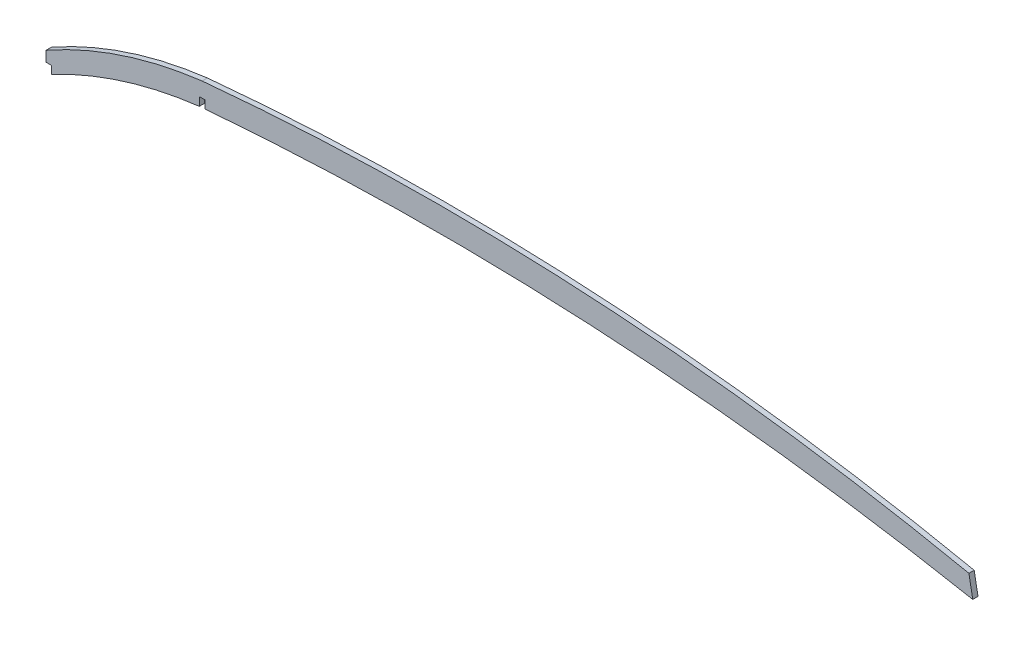
from build123d import *

# Parameters (mm, degrees)
BOSS_EXTRUDE1_DEPTH = 3.175
SKETCH2_W           = 3.3528
SKETCH2_H           = 6.477
SKETCH2_W_2         = 3.3782
SKETCH2_H_2         = 6.2738
CUT_EXTRUDE1_DEPTH  = 577.346072705


with BuildPart() as part:
    # Sketch1 → Boss-Extrude1 (new body)
    with BuildSketch(Plane.XY):
        with BuildLine():
            Line((557.916984218, 99.326538403), (555.638244479, 111.822940833))
            ThreePointArc((555.638244479, 111.822940833), (325.782502236, 142.132503557), (93.98, 137.668))
            ThreePointArc((93.98, 137.668), (45.466310815, 126.795024577), (0, 106.68))
            Line((0, 106.68), (0, 93.98))
            ThreePointArc((0, 93.98), (45.52945751, 113.491169294), (93.98, 123.794671649))
            ThreePointArc((93.98, 123.794671649), (326.784483289, 127.411721364), (557.916984218, 99.326538403))
        make_face()
    extrude(amount=-BOSS_EXTRUDE1_DEPTH)

    # Sketch2 → Cut-Extrude1 (cut, through all)
    with BuildSketch(Plane(origin=(0, 0, -3.175), x_dir=(-1, 0, 0), z_dir=(0, 0, -1))):
        with Locations((-1.6764, 97.2185)):
            Rectangle(SKETCH2_W, SKETCH2_H)
        with Locations((-93.98, 125.559446899)):
            Rectangle(SKETCH2_W_2, SKETCH2_H_2)
    extrude(amount=-CUT_EXTRUDE1_DEPTH, mode=Mode.SUBTRACT)


solid = part.part
